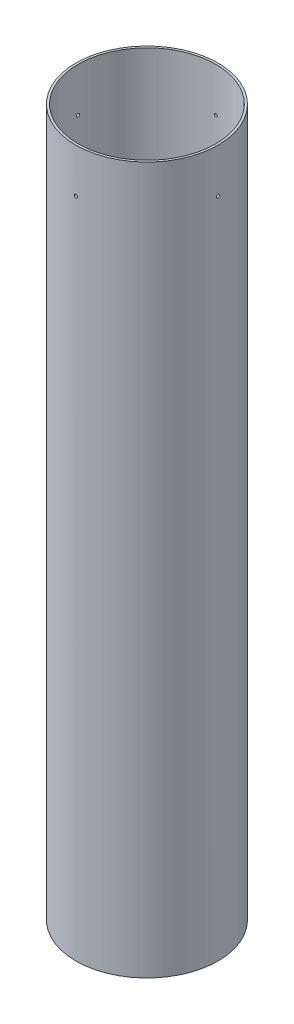
from build123d import *

# Parameters (mm, degrees)
SKETCH1_R           = 51.1048
SKETCH1_R_2         = 49.53
BOSS_EXTRUDE1_DEPTH = 508
SKETCH2_R           = 1.0922
CUT_EXTRUDE1_DEPTH  = 514.11538777
CIRPATTERN2_COUNT   = 4


with BuildPart() as part:
    # Sketch1 → Boss-Extrude1 (new body)
    with BuildSketch(Plane(origin=(0, 0, 0), x_dir=(1, 0, 0), z_dir=(0, 1, 0))):
        Circle(SKETCH1_R)
        Circle(SKETCH1_R_2, mode=Mode.SUBTRACT)
    extrude(amount=BOSS_EXTRUDE1_DEPTH)

    # Sketch2 → Cut-Extrude1 (cut, through all)
    with BuildSketch(Plane.XY):
        with Locations((0, 476.25)):
            Circle(SKETCH2_R)
    cut_extrude1 = extrude(amount=-CUT_EXTRUDE1_DEPTH, mode=Mode.SUBTRACT)

    # CirPattern2: Cut-Extrude1 ×4 about axis
    cirpattern2_axis = Axis((0, 508, 0), (0, -1, 0))
    for i in range(1, CIRPATTERN2_COUNT):
        add(cut_extrude1.rotate(cirpattern2_axis, i * 360 / CIRPATTERN2_COUNT), mode=Mode.SUBTRACT)


solid = part.part
